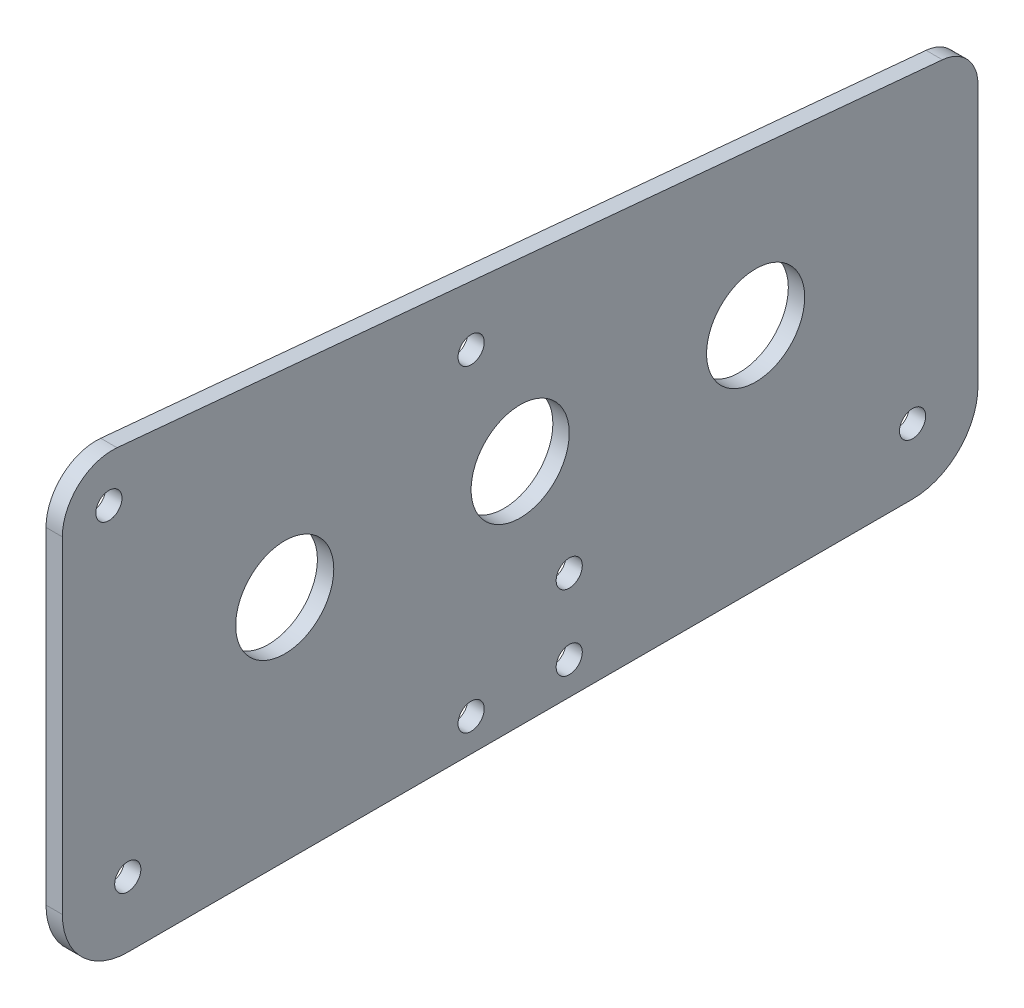
from build123d import *

# Parameters (mm, degrees)
SKETCH1_R                  = 2.54
SKETCH1_R_2                = 9.525
BOSS_EXTRUDE1_DEPTH        = 4.7625
CONVERT_SOLID1_OUTLINE_R   = 2.54
CONVERT_SOLID1_OUTLINE_R_2 = 9.525
CONVERT_SOLID1_DEPTH       = 1.5875


# Read off the part's stored shape, not the designer's step: Convert-Solid1
with BuildPart() as part:
    # Sketch1 → Boss-Extrude1 (new body)
    with BuildSketch(Plane(origin=(0, 0, 0), x_dir=(0, 0, -1), z_dir=(1, 0, 0))):
        with BuildLine():
            Line((517.497208961, 116.457539853), (677.757490375, 101.56617639))
            ThreePointArc((677.757490375, 101.56617639), (682.684377991, 99.111706327), (684.672478048, 93.978860817))
            Line((684.672478048, 93.978860817), (684.672478048, 43.274288567))
            ThreePointArc((684.672478048, 43.274288567), (680.952734169, 34.294032445), (671.972478048, 30.574288567))
            Line((671.972478048, 30.574288567), (519.572478048, 30.574288567))
            ThreePointArc((519.572478048, 30.574288567), (510.592221927, 34.294032445), (506.872478048, 43.274288567))
            Line((506.872478048, 43.274288567), (506.872478048, 106.774288567))
            ThreePointArc((506.872478048, 106.774288567), (510.046689227, 113.961956173), (517.497208961, 116.457539853))
        make_face()
        with Locations(Location((515.911244675, 107.527203865, 0), (0, 0, 180))):
            Circle(SKETCH1_R, mode=Mode.SUBTRACT)
        with Locations(Location((550.052478048, 75.024288567, 0), (0, 0, 180))):
            Circle(SKETCH1_R_2, mode=Mode.SUBTRACT)
        with Locations(Location((595.772478048, 75.024288567, 0), (0, 0, 180))):
            Circle(SKETCH1_R_2, mode=Mode.SUBTRACT)
        with Locations(Location((605.297478048, 51.47785837, 0), (0, 0, 180))):
            Circle(SKETCH1_R, mode=Mode.SUBTRACT)
        with Locations(Location((586.247478048, 98.570718763, 0), (0, 0, 180))):
            Circle(SKETCH1_R, mode=Mode.SUBTRACT)
        with Locations(Location((641.492478048, 75.024288567, 0), (0, 0, 180))):
            Circle(SKETCH1_R_2, mode=Mode.SUBTRACT)
        with Locations(Location((605.297478048, 36.924288567, 0), (0, 0, 180))):
            Circle(SKETCH1_R, mode=Mode.SUBTRACT)
        with Locations(Location((586.247478048, 36.924288567, 0), (0, 0, 180))):
            Circle(SKETCH1_R, mode=Mode.SUBTRACT)
        with Locations(Location((519.572478048, 43.274288567, 0), (0, 0, 180))):
            Circle(SKETCH1_R, mode=Mode.SUBTRACT)
        with Locations(Location((671.972478048, 43.274288567, 0), (0, 0, 180))):
            Circle(SKETCH1_R, mode=Mode.SUBTRACT)
    extrude(amount=BOSS_EXTRUDE1_DEPTH)

    # Convert-Solid1 outline → Convert-Solid1 (cut)
    with BuildSketch(Plane.YZ):
        with BuildLine():
            ThreePointArc((116.457539853, -517.497208961), (113.961956173, -510.046689227), (106.774288567, -506.872478048))
            Line((106.774288567, -506.872478048), (43.274288567, -506.872478048))
            ThreePointArc((43.274288567, -506.872478048), (34.294032446, -510.592221927), (30.574288567, -519.572478048))
            Line((30.574288567, -519.572478048), (30.574288567, -671.972478048))
            ThreePointArc((30.574288567, -671.972478048), (34.294032445, -680.952734169), (43.274288567, -684.672478048))
            Line((43.274288567, -684.672478048), (93.978860817, -684.672478048))
            ThreePointArc((93.978860817, -684.672478048), (99.111706327, -682.684377991), (101.56617639, -677.757490375))
            Line((101.56617639, -677.757490375), (116.457539853, -517.497208961))
        make_face()
        with Locations((43.274288567, -671.972478048)):
            Circle(CONVERT_SOLID1_OUTLINE_R, mode=Mode.SUBTRACT)
        with Locations((36.924288567, -605.297478048)):
            Circle(CONVERT_SOLID1_OUTLINE_R, mode=Mode.SUBTRACT)
        with Locations((51.47785837, -605.297478048)):
            Circle(CONVERT_SOLID1_OUTLINE_R, mode=Mode.SUBTRACT)
        with Locations((75.024288567, -641.492478048)):
            Circle(CONVERT_SOLID1_OUTLINE_R_2, mode=Mode.SUBTRACT)
        with Locations((75.024288567, -595.772478048)):
            Circle(CONVERT_SOLID1_OUTLINE_R_2, mode=Mode.SUBTRACT)
        with Locations((36.924288567, -586.247478048)):
            Circle(CONVERT_SOLID1_OUTLINE_R, mode=Mode.SUBTRACT)
        with Locations((43.274288567, -519.572478048)):
            Circle(CONVERT_SOLID1_OUTLINE_R, mode=Mode.SUBTRACT)
        with Locations((98.570718763, -586.247478048)):
            Circle(CONVERT_SOLID1_OUTLINE_R, mode=Mode.SUBTRACT)
        with Locations((75.024288567, -550.052478048)):
            Circle(CONVERT_SOLID1_OUTLINE_R_2, mode=Mode.SUBTRACT)
        with Locations((107.527203865, -515.911244675)):
            Circle(CONVERT_SOLID1_OUTLINE_R, mode=Mode.SUBTRACT)
    extrude(amount=CONVERT_SOLID1_DEPTH, mode=Mode.SUBTRACT)


solid = part.part
